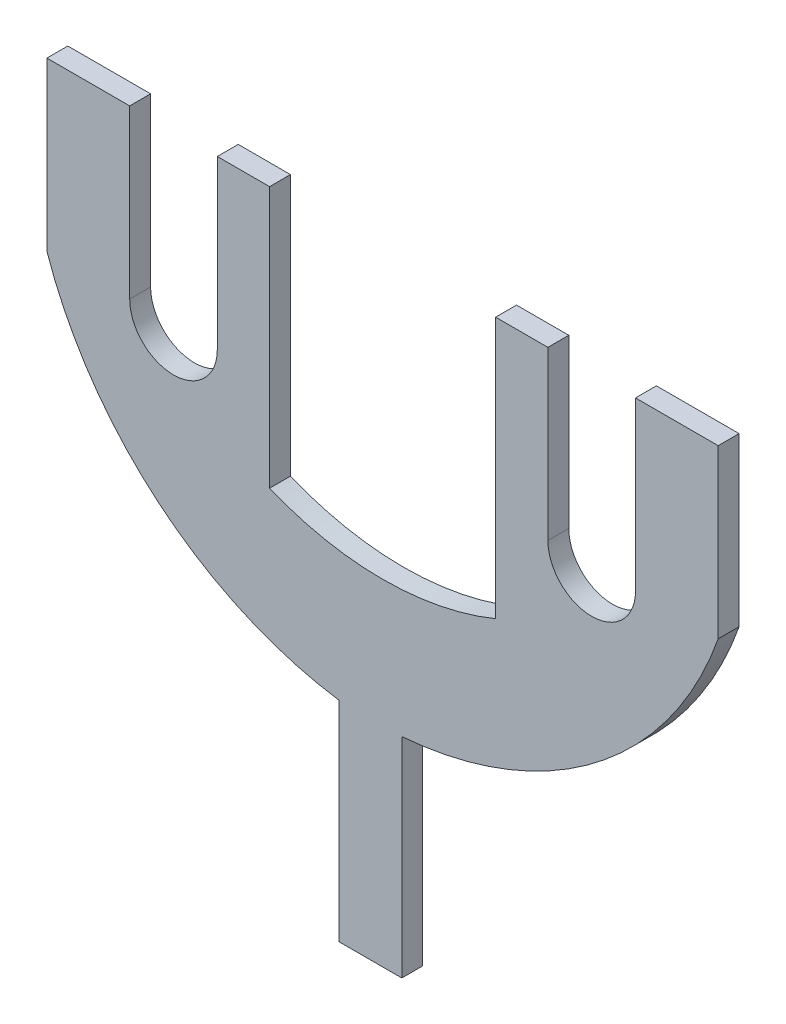
from build123d import *

# Parameters (mm, degrees)
BOSS_EXTRUDE2_DEPTH = 1


with BuildPart() as part:
    # Sketch2 → Boss-Extrude2 (new body)
    with BuildSketch(Plane.XY):
        with BuildLine():
            Line((-21.105029961, 21.487770019), (-17.145029961, 21.487770019))
            Line((-17.145029961, 21.487770019), (-17.145029961, 13.487770019))
            ThreePointArc((-17.145029961, 13.487770019), (-15.050029961, 11.392770019), (-12.955029961, 13.487770019))
            Line((-12.955029961, 13.487770019), (-12.955029961, 21.487770019))
            Line((-12.955029961, 21.487770019), (-10.455029961, 21.487770019))
            Line((-10.455029961, 21.487770019), (-10.455029961, 8.998253579))
            ThreePointArc((-10.455029961, 8.998253579), (-5.050029961, 7.928985553), (0.354970039, 8.998253579))
            Line((0.354970039, 8.998253579), (0.354970039, 21.487770019))
            Line((0.354970039, 21.487770019), (2.854970039, 21.487770019))
            Line((2.854970039, 21.487770019), (2.854970039, 13.487770019))
            ThreePointArc((2.854970039, 13.487770019), (4.949970039, 11.392770019), (7.044970039, 13.487770019))
            Line((7.044970039, 13.487770019), (7.044970039, 21.487770019))
            Line((7.044970039, 21.487770019), (11, 21.487770019))
            Line((11, 21.487770019), (11, 13.487770019))
            ThreePointArc((11, 13.487770019), (5.155621357, 5.438141294), (-4.131514483, 1.874099734))
            Line((-4.131514483, 1.874099734), (-4.131514483, -8.125900266))
            Line((-4.131514483, -8.125900266), (-7.131514483, -8.125900266))
            Line((-7.131514483, -8.125900266), (-7.131514483, 1.874099734))
            ThreePointArc((-7.131514483, 1.874099734), (-15.743619149, 5.725324816), (-21.105029961, 13.487770019))
            Line((-21.105029961, 13.487770019), (-21.105029961, 21.487770019))
        make_face()
    extrude(amount=BOSS_EXTRUDE2_DEPTH)


solid = part.part
